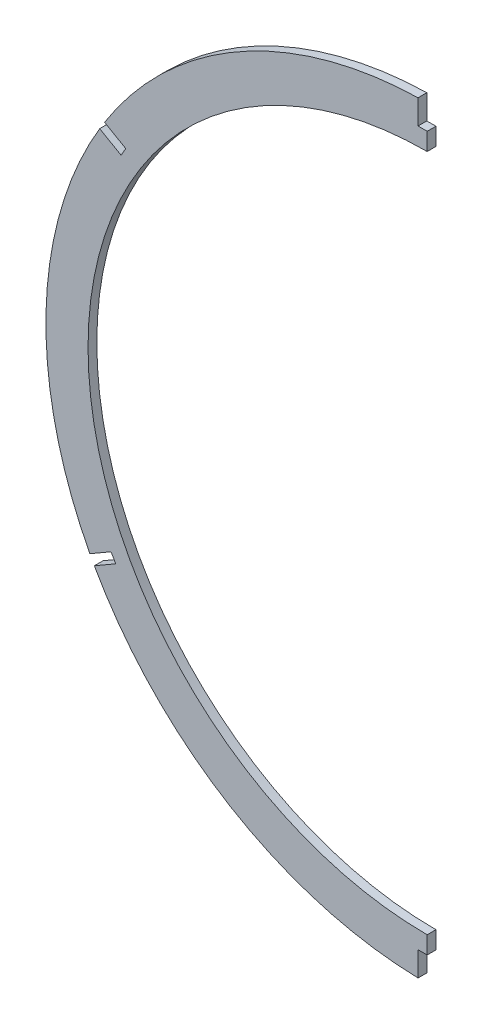
from build123d import *

# Parameters (mm, degrees)
SKETCH2_R           = 137.922
SKETCH2_R_2         = 122.682
BOSS_EXTRUDE2_DEPTH = 1.5875
SKETCH3_W           = 290.977734258
SKETCH3_H           = 504.828840158
CUT_EXTRUDE1_DEPTH  = 205.235122161
CUT_EXTRUDE2_DEPTH  = 205.25363055


with BuildPart() as part:
    # Sketch2 → Boss-Extrude2 (new, symmetric)
    with BuildSketch(Plane(origin=(248.273568551, -245.01347209, 0), x_dir=(0, -1, 0), z_dir=(0, 0, -1))):
        with Locations((-257.71347209, 248.273568551)):
            Circle(SKETCH2_R)
        with Locations((-257.71347209, 248.273568551)):
            Circle(SKETCH2_R_2, mode=Mode.SUBTRACT)
    extrude(amount=BOSS_EXTRUDE2_DEPTH, both=True)

    # Sketch3 → Cut-Extrude1 (cut, through all)
    with BuildSketch(Plane(origin=(0, 0, 0), x_dir=(0, 0, -1), z_dir=(1, 0, 0))):
        with Locations((4.206907001, 10.947122083)):
            Rectangle(SKETCH3_W, SKETCH3_H)
    extrude(amount=CUT_EXTRUDE1_DEPTH, mode=Mode.SUBTRACT)

    # Sketch5 → Cut-Extrude2 (cut, through all)
    with BuildSketch(Plane.XY.offset(1.5875)):
        with BuildLine():
            Line((-3.302, 150.582467631), (-3.302, 141.732))
            Line((-3.302, 141.732), (0, 141.732))
            Line((0, 141.732), (0, 150.622))
            ThreePointArc((0, 150.622), (-1.651118319, 150.612116554), (-3.302, 150.582467631))
        make_face()
        with BuildLine():
            Line((-3.302, -116.332), (-3.302, -125.182467631))
            ThreePointArc((-3.302, -125.182467631), (-1.651118319, -125.212116554), (0, -125.222))
            Line((0, -125.222), (0, -116.332))
            Line((0, -116.332), (-3.302, -116.332))
        make_face()
        with BuildLine():
            Line((-114.354109205, -47.189929975), (-122.010798327, -51.610521501))
            ThreePointArc((-122.010798327, -51.610521501), (-121.213773508, -53.100449816), (-120.398555388, -54.580501964))
            Line((-120.398555388, -54.580501964), (-112.665009205, -50.115536994))
            Line((-112.665009205, -50.115536994), (-114.354109205, -47.189929975))
        make_face()
        with BuildLine():
            Line((-109.043255392, 81.788598611), (-116.699944513, 86.209190137))
            ThreePointArc((-116.699944513, 86.209190137), (-117.591747875, 84.773982239), (-118.465901574, 83.327956562))
            Line((-118.465901574, 83.327956562), (-110.732355392, 78.862991592))
            Line((-110.732355392, 78.862991592), (-109.043255392, 81.788598611))
        make_face()
    extrude(amount=-CUT_EXTRUDE2_DEPTH, mode=Mode.SUBTRACT)


solid = part.part
